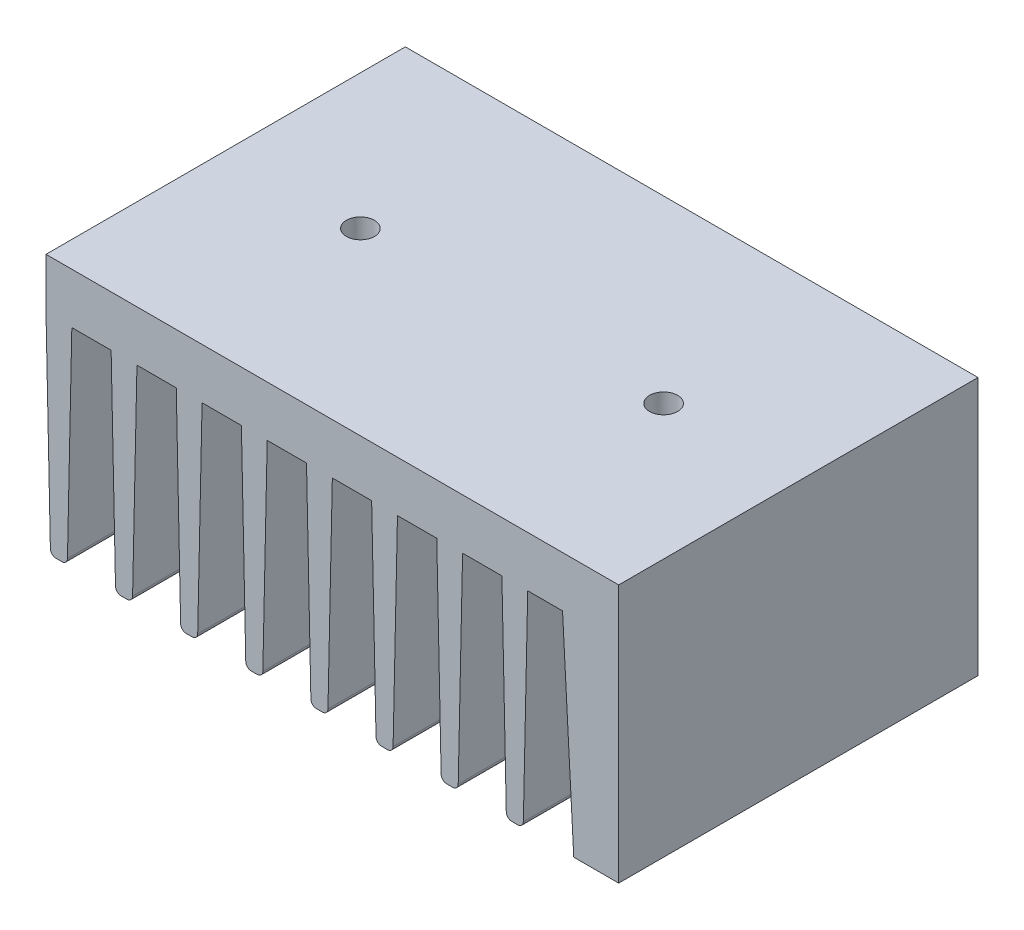
from build123d import *

# Parameters (mm, degrees)
SKETCH1_W              = 51
SKETCH1_H              = 32
BOSS_EXTRUDE1_DEPTH    = 4.5
FILLET1_R              = 0.5
LPATTERN1_COUNT        = 8
LPATTERN1_PITCH        = 5.8
FILLET1_OF_LPATTERN1_R = 0.5
M3X0_5_TAPPED_HOLE1_D  = 2.5


# Read off the part's stored shape, not the designer's step: Mirror1
with BuildPart() as part:
    # Sketch1 → Boss-Extrude1 (new body)
    with BuildSketch(Plane(origin=(0, 0, 0), x_dir=(1, 0, 0), z_dir=(0, 1, 0))):
        Rectangle(SKETCH1_W, SKETCH1_H)
    extrude(amount=-BOSS_EXTRUDE1_DEPTH)

    # Sketch2 → Loft1 section 0
    with BuildSketch(Plane(origin=(0, -4.5, 0), x_dir=(-1, 0, 0), z_dir=(0, -1, 0))):
        with BuildLine():
            Line((25.5, -16), (23.2, -16))
            Line((23.2, -16), (23.2, 16))
            Line((23.2, 16), (25.5, 16))
            Line((25.5, 16), (25.5, -16))
        make_face()
    # Sketch3 → Loft1 section 1
    with BuildSketch(Plane(origin=(0, -23, 0), x_dir=(1, 0, 0), z_dir=(0, 1, 0))):
        with BuildLine():
            Line((-23.6, -16), (-25.1, -16))
            Line((-25.1, -16), (-25.1, 16))
            Line((-25.1, 16), (-23.6, 16))
            Line((-23.6, 16), (-23.6, -16))
        make_face()
    loft1 = loft()

    # Fillet1
    fillet1_edges = [part.edges().sort_by_distance(p)[0] for p in [
        (-25.1, -23, 0),
        (-23.6, -23, 0),
    ]]
    fillet(fillet1_edges, radius=FILLET1_R)

    # LPattern1: Loft1 ×8
    with Locations(*[(i * LPATTERN1_PITCH, 0, 0) for i in range(1, LPATTERN1_COUNT)]):
        add(loft1)

    # Fillet1 of LPattern1
    fillet1_of_lpattern1_edges = [part.edges().sort_by_distance(p)[0] for p in [
        (-19.3, -23, 0),
        (-17.8, -23, 0),
        (-13.5, -23, 0),
        (-12, -23, 0),
        (-7.7, -23, 0),
        (-6.2, -23, 0),
        (-1.9, -23, 0),
        (-0.4, -23, 0),
        (3.9, -23, 0),
        (5.4, -23, 0),
        (9.7, -23, 0),
        (11.2, -23, 0),
        (15.5, -23, 0),
        (17, -23, 0),
    ]]
    fillet(fillet1_of_lpattern1_edges, radius=FILLET1_OF_LPATTERN1_R)

    # Sketch5 → Loft2 section 0
    with BuildSketch(Plane(origin=(0, -23, 0), x_dir=(1, 0, 0), z_dir=(0, 1, 0))):
        with BuildLine():
            Line((25.5, -16), (21.5, -16))
            Line((21.5, -16), (21.5, 16))
            Line((21.5, 16), (25.5, 16))
            Line((25.5, 16), (25.5, -16))
        make_face()
    # Sketch4 → Loft2 section 1
    with BuildSketch(Plane(origin=(0, -4.5, 0), x_dir=(-1, 0, 0), z_dir=(0, -1, 0))):
        with BuildLine():
            Line((-25.5, -16), (-20.5, -16))
            Line((-20.5, -16), (-20.5, 16))
            Line((-20.5, 16), (-25.5, 16))
            Line((-25.5, 16), (-25.5, -16))
        make_face()
    loft()

    # M3x0.5 Tapped Hole1 (through all)
    with Locations(Plane(origin=(0, 0, 0), x_dir=(1, 0, 0), z_dir=(0, 1, 0))):
        with Locations((13.5, 0)):
            Hole(M3X0_5_TAPPED_HOLE1_D / 2)

    # Mirror1 outline → Mirror1 (revolve, cut)
    with BuildSketch(Plane(origin=(-13.5, 0, 0), x_dir=(1, 0, 0), z_dir=(0, 0, 1))):
        Polygon((0, 0), (0, -5.251075774), (1.250000005, -4.499999997), (1.25, 0), align=None)
    revolve(axis=Axis((-13.5, 0, 0), (0, 1, 0)), mode=Mode.SUBTRACT)


solid = part.part
